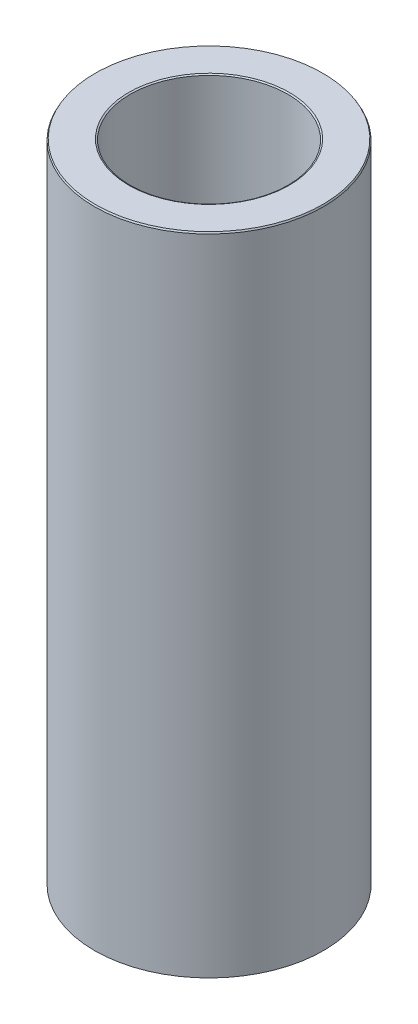
from build123d import *
from OCP.BRepFilletAPI import BRepFilletAPI_MakeChamfer

# Parameters (mm, degrees)
SKETCH1_R           = 45
BOSS_EXTRUDE1_DEPTH = 253.903079953
SKETCH2_R           = 30.979362666
CUT_EXTRUDE1_DEPTH  = 262.757089703
CHAMFER1_SIZE       = 0.579084056
CHAMFER1_SIZE2      = 0.334334336


with BuildPart() as part:
    # Sketch1 → Boss-Extrude1 (new body)
    with BuildSketch(Plane(origin=(0, 0, 0), x_dir=(1, 0, 0), z_dir=(0, 1, 0))):
        Circle(SKETCH1_R)
    extrude(amount=BOSS_EXTRUDE1_DEPTH)

    # Sketch2 → Cut-Extrude1 (cut, through all)
    with BuildSketch(Plane(origin=(0, 0, 0), x_dir=(1, 0, 0), z_dir=(0, 1, 0))):
        Circle(SKETCH2_R)
    extrude(amount=CUT_EXTRUDE1_DEPTH, mode=Mode.SUBTRACT)

    # Chamfer1: one chamfer whose edges measure the first distance from different faces: ONE call of the kernel's chamfer builder (chamfer() names one face for all edges)
    chamfer1_edges_1 = [part.edges().sort_by_distance(p)[0] for p in [
        (-30.979362666, 253.903079953, 0),
    ]]
    chamfer1_side_1 = [part.faces().sort_by_distance(p)[0] for p in [
        (-43.727207794, 253.903079953, 0),
    ]]
    chamfer1_edges_2 = [part.edges().sort_by_distance(p)[0] for p in [
        (-30.979362666, 0, 0),
    ]]
    chamfer1_side_2 = [part.faces().sort_by_distance(p)[0] for p in [
        (-30.979362666, 126.951539977, 0),
    ]]
    chamfer1_edges_3 = [part.edges().sort_by_distance(p)[0] for p in [
        (-45, 0, 0),
    ]]
    chamfer1_side_3 = [part.faces().sort_by_distance(p)[0] for p in [
        (-43.727207794, 0, 0),
    ]]
    chamfer1_edges_4 = [part.edges().sort_by_distance(p)[0] for p in [
        (-45, 253.903079953, 0),
    ]]
    chamfer1_side_4 = [part.faces().sort_by_distance(p)[0] for p in [
        (-45, 126.951539977, 0),
    ]]
    chamfer1 = BRepFilletAPI_MakeChamfer(part.part.solid().wrapped)
    for e in chamfer1_edges_1:
        chamfer1.Add(CHAMFER1_SIZE, CHAMFER1_SIZE2, e.wrapped, chamfer1_side_1[0].wrapped)  # the first distance lies on this face
    for e in chamfer1_edges_2:
        chamfer1.Add(CHAMFER1_SIZE, CHAMFER1_SIZE2, e.wrapped, chamfer1_side_2[0].wrapped)  # the first distance lies on this face
    for e in chamfer1_edges_3:
        chamfer1.Add(CHAMFER1_SIZE, CHAMFER1_SIZE2, e.wrapped, chamfer1_side_3[0].wrapped)  # the first distance lies on this face
    for e in chamfer1_edges_4:
        chamfer1.Add(CHAMFER1_SIZE, CHAMFER1_SIZE2, e.wrapped, chamfer1_side_4[0].wrapped)  # the first distance lies on this face
    add(Compound.cast(chamfer1.Shape()), mode=Mode.REPLACE)


solid = part.part
